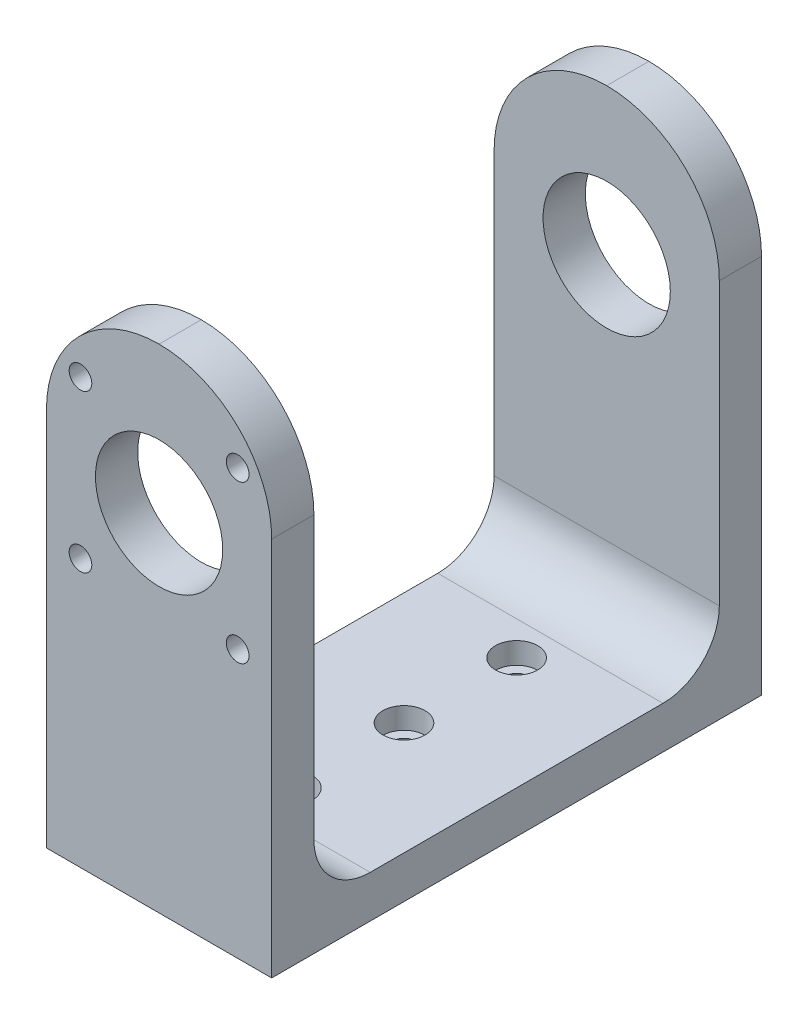
from build123d import *

# Parameters (mm, degrees)
SKETCH1_W           = 50.8
SKETCH1_H           = 110.49
BOSS_EXTRUDE1_DEPTH = 9.525
SKETCH2_W           = 50.8
SKETCH2_H           = 9.525
BOSS_EXTRUDE2_DEPTH = 101.6
SKETCH3_W           = 50.8
SKETCH3_H           = 9.525
BOSS_EXTRUDE3_DEPTH = 101.6
SKETCH8_R           = 14.351
CUT_EXTRUDE7_DEPTH  = 165.734470361
SKETCH9_R           = 2.5527
CUT_EXTRUDE8_DEPTH  = 159.503428512
SKETCH10_R          = 2.5527
CUT_EXTRUDE9_DEPTH  = 6.35
FILLET5_R           = 25.4
FILLET6_R           = 25.4
FILLET7_R           = 25.4
FILLET8_R           = 25.4
SKETCH11_R          = 2.5527
CUT_EXTRUDE10_DEPTH = 159.465264648
SKETCH12_R          = 2.54
CUT_EXTRUDE11_DEPTH = 159.465264648
FILLET9_R           = 12.7
SKETCH13_R          = 4.7625
CUT_EXTRUDE12_DEPTH = 4.826


with BuildPart() as part:
    # Sketch1 → Boss-Extrude1 (new body)
    with BuildSketch(Plane(origin=(0, 0, 0), x_dir=(1, 0, 0), z_dir=(0, 1, 0))):
        with Locations((25.4, 55.245)):
            Rectangle(SKETCH1_W, SKETCH1_H)
    extrude(amount=BOSS_EXTRUDE1_DEPTH)

    # Sketch2 → Boss-Extrude2 (add)
    with BuildSketch(Plane(origin=(0, 9.525, 0), x_dir=(1, 0, 0), z_dir=(0, 1, 0))):
        with Locations((25.4, 105.7275)):
            Rectangle(SKETCH2_W, SKETCH2_H)
    extrude(amount=BOSS_EXTRUDE2_DEPTH)

    # Sketch3 → Boss-Extrude3 (add)
    with BuildSketch(Plane(origin=(0, 9.525, 0), x_dir=(1, 0, 0), z_dir=(0, 1, 0))):
        with Locations((25.4, 4.7625)):
            Rectangle(SKETCH3_W, SKETCH3_H)
    extrude(amount=BOSS_EXTRUDE3_DEPTH)

    # Sketch8 → Cut-Extrude7 (cut, through all)
    with BuildSketch(Plane.XY):
        with Locations((25.4, 78.105)):
            Circle(SKETCH8_R)
    extrude(amount=-CUT_EXTRUDE7_DEPTH, mode=Mode.SUBTRACT)

    # Sketch9 → Cut-Extrude8 (cut, through all)
    with BuildSketch(Plane(origin=(0, 0, -9.525), x_dir=(-1, 0, 0), z_dir=(0, 0, -1))):
        with Locations((-43.1292, 95.8342)):
            Circle(SKETCH9_R)
        with Locations((-7.6708, 95.8342)):
            Circle(SKETCH9_R)
        with Locations((-7.6708, 60.3758)):
            Circle(SKETCH9_R)
        with Locations((-43.1292, 60.3758)):
            Circle(SKETCH9_R)
    extrude(amount=-CUT_EXTRUDE8_DEPTH, mode=Mode.SUBTRACT)

    # Sketch10 → Cut-Extrude9 (cut)
    with BuildSketch(Plane(origin=(0, 0, -110.49), x_dir=(-1, 0, 0), z_dir=(0, 0, -1))):
        with Locations((-43.1292, 95.8342)):
            Circle(SKETCH10_R)
        with Locations((-7.6708, 95.8342)):
            Circle(SKETCH10_R)
        with Locations((-7.6708, 60.3758)):
            Circle(SKETCH10_R)
        with Locations((-43.1292, 60.3758)):
            Circle(SKETCH10_R)
    extrude(amount=-CUT_EXTRUDE9_DEPTH, mode=Mode.SUBTRACT)

    # Fillet5
    fillet5_edges = [part.edges().sort_by_distance(p)[0] for p in [
        (0, 111.125, -4.7625),
    ]]
    fillet(fillet5_edges, radius=FILLET5_R)

    # Fillet6
    fillet6_edges = [part.edges().sort_by_distance(p)[0] for p in [
        (50.8, 111.125, -4.7625),
    ]]
    fillet(fillet6_edges, radius=FILLET6_R - 0.0001)  # a hair under: the kernel refuses the full size

    # Fillet7
    fillet7_edges = [part.edges().sort_by_distance(p)[0] for p in [
        (0, 111.125, -105.7275),
    ]]
    fillet(fillet7_edges, radius=FILLET7_R)

    # Fillet8
    fillet8_edges = [part.edges().sort_by_distance(p)[0] for p in [
        (50.8, 111.125, -105.7275),
    ]]
    fillet(fillet8_edges, radius=FILLET8_R - 0.0001)  # a hair under: the kernel refuses the full size

    # Sketch11 → Cut-Extrude10 (cut, through all)
    with BuildSketch(Plane(origin=(0, 9.525, 0), x_dir=(1, 0, 0), z_dir=(0, 1, 0))):
        with Locations(Location((25.4, 55.245, 0), (0, 0, 270))):
            Circle(SKETCH11_R)
    extrude(amount=-CUT_EXTRUDE10_DEPTH, mode=Mode.SUBTRACT)

    # Sketch12 → Cut-Extrude11 (cut, through all)
    with BuildSketch(Plane(origin=(0, 9.525, 0), x_dir=(1, 0, 0), z_dir=(0, 1, 0))):
        with Locations(Location((25.4, 29.845, 0), (0, 0, 270))):
            Circle(SKETCH12_R)
        with Locations(Location((25.4, 80.645, 0), (0, 0, 270))):
            Circle(SKETCH12_R)
    extrude(amount=-CUT_EXTRUDE11_DEPTH, mode=Mode.SUBTRACT)

    # Fillet9
    fillet9_edges = [part.edges().sort_by_distance(p)[0] for p in [
        (25.4, 9.525, -100.965),
        (25.4, 9.525, -9.525),
    ]]
    fillet(fillet9_edges, radius=FILLET9_R)

    # Sketch13 → Cut-Extrude12 (cut)
    with BuildSketch(Plane(origin=(0, 9.525, 0), x_dir=(1, 0, 0), z_dir=(0, 1, 0))):
        with Locations(Location((25.4, 55.245, 0), (0, 0, 270))):
            Circle(SKETCH13_R)
        with Locations(Location((25.4, 29.845, 0), (0, 0, 270))):
            Circle(SKETCH13_R)
        with Locations(Location((25.4, 80.645, 0), (0, 0, 270))):
            Circle(SKETCH13_R)
    extrude(amount=-CUT_EXTRUDE12_DEPTH, mode=Mode.SUBTRACT)


solid = part.part
